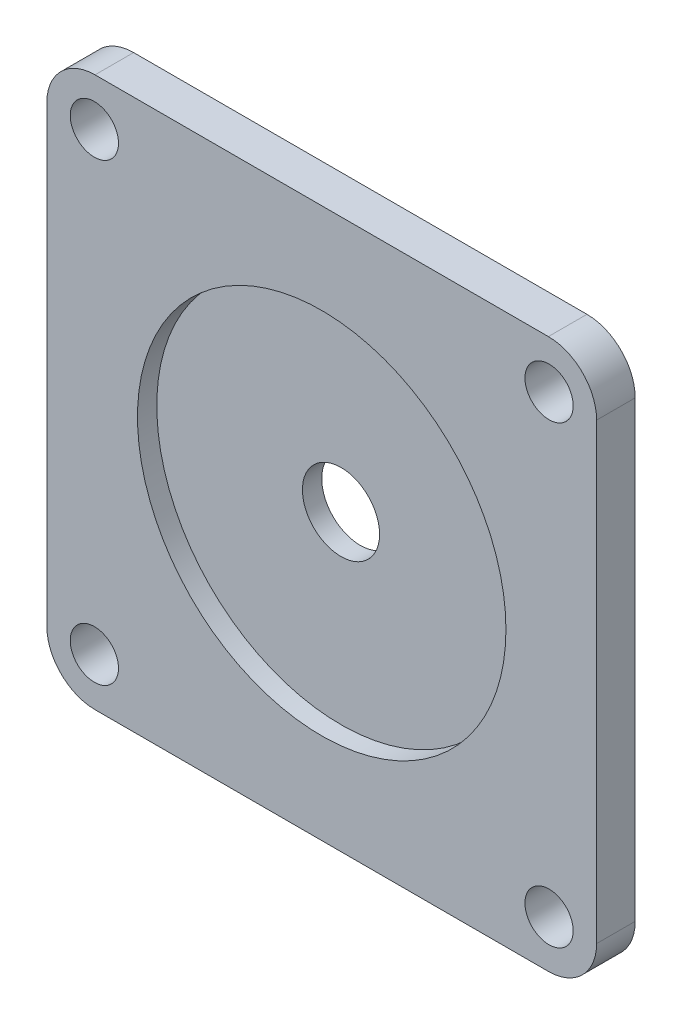
from build123d import *

# Parameters (mm, degrees)
SKIZZE1_W                       = 57
SKIZZE1_H                       = 57
AUFSATZ_LINEAR_AUSTRAGEN1_DEPTH = 4
F_5_0_5_DURCHMESSER_BOHRUNG2_D  = 5
VERRUNDUNG1_R                   = 5
SKIZZE6_R                       = 19.1
SCHNITT_LINEAR_AUSTRAGEN1_DEPTH = 2
F_8_0_8_DURCHMESSER_BOHRUNG1_D  = 8


with BuildPart() as part:
    # Skizze1 → Aufsatz-Linear austragen1 (new body)
    with BuildSketch(Plane.XY):
        Rectangle(SKIZZE1_W, SKIZZE1_H)
    extrude(amount=AUFSATZ_LINEAR_AUSTRAGEN1_DEPTH)

    # Ø5.0 (5) Durchmesser Bohrung2 (through all)
    with Locations(Plane.XY.offset(4)):
        with Locations((-23.57, 23.57), (23.57, 23.57), (23.57, -23.57), (-23.57, -23.57)):
            Hole(F_5_0_5_DURCHMESSER_BOHRUNG2_D / 2)

    # Verrundung1
    verrundung1_edges = [part.edges().sort_by_distance(p)[0] for p in [
        (-28.5, 28.5, 2),
        (-28.5, -28.5, 2),
        (28.5, -28.5, 2),
        (28.5, 28.5, 2),
    ]]
    fillet(verrundung1_edges, radius=VERRUNDUNG1_R)

    # Skizze6 → Schnitt-Linear austragen1 (cut)
    with BuildSketch(Plane.XY.offset(4)):
        Circle(SKIZZE6_R)
    extrude(amount=-SCHNITT_LINEAR_AUSTRAGEN1_DEPTH, mode=Mode.SUBTRACT)

    # Ø8.0 (8) Durchmesser Bohrung1 (through all)
    with Locations(Plane.XY.offset(2)):
        with Locations((0, 0)):
            Hole(F_8_0_8_DURCHMESSER_BOHRUNG1_D / 2)


solid = part.part
